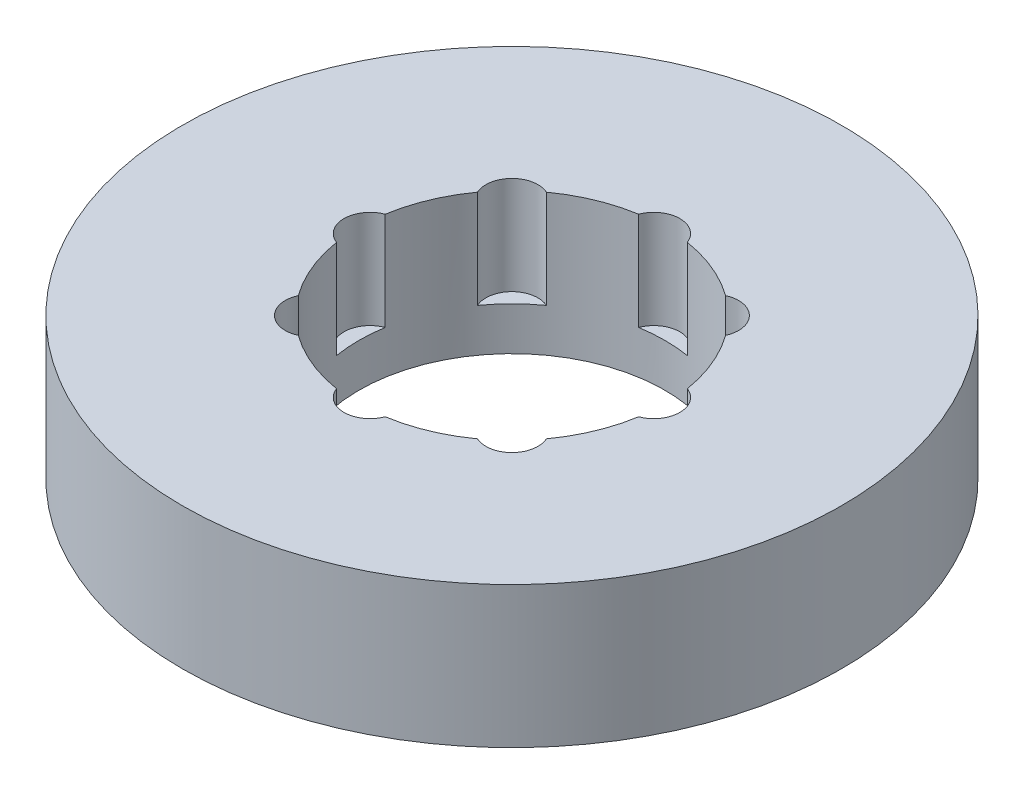
from build123d import *

# Parameters (mm, degrees)
SKETCH1_R           = 70
BOSS_EXTRUDE1_DEPTH = 30
SKETCH2_R           = 32.5
CUT_EXTRUDE1_DEPTH  = 104.440804328
SKETCH3_R           = 5.529388336
CUT_EXTRUDE2_DEPTH  = 20.829870727
CIRPATTERN1_COUNT   = 8


with BuildPart() as part:
    # Sketch1 → Boss-Extrude1 (new body)
    with BuildSketch(Plane(origin=(0, 0, 0), x_dir=(1, 0, 0), z_dir=(0, 1, 0))):
        Circle(SKETCH1_R)
    extrude(amount=BOSS_EXTRUDE1_DEPTH)

    # Sketch2 → Cut-Extrude1 (cut, through all)
    with BuildSketch(Plane(origin=(0, 0, 0), x_dir=(1, 0, 0), z_dir=(0, 1, 0))):
        Circle(SKETCH2_R)
    extrude(amount=CUT_EXTRUDE1_DEPTH, mode=Mode.SUBTRACT)

    # Sketch3 → Cut-Extrude2 (cut)
    with BuildSketch(Plane(origin=(0, 30, 0), x_dir=(1, 0, 0), z_dir=(0, 1, 0))):
        with Locations((-30.13515682, 0)):
            Circle(SKETCH3_R)
    cut_extrude2 = extrude(amount=-CUT_EXTRUDE2_DEPTH, mode=Mode.SUBTRACT)

    # CirPattern1: Cut-Extrude2 ×8 about axis
    cirpattern1_axis = Axis((0, 0, 0), (0, 1, 0))
    for i in range(1, CIRPATTERN1_COUNT):
        add(cut_extrude2.rotate(cirpattern1_axis, i * 360 / CIRPATTERN1_COUNT), mode=Mode.SUBTRACT)


solid = part.part
